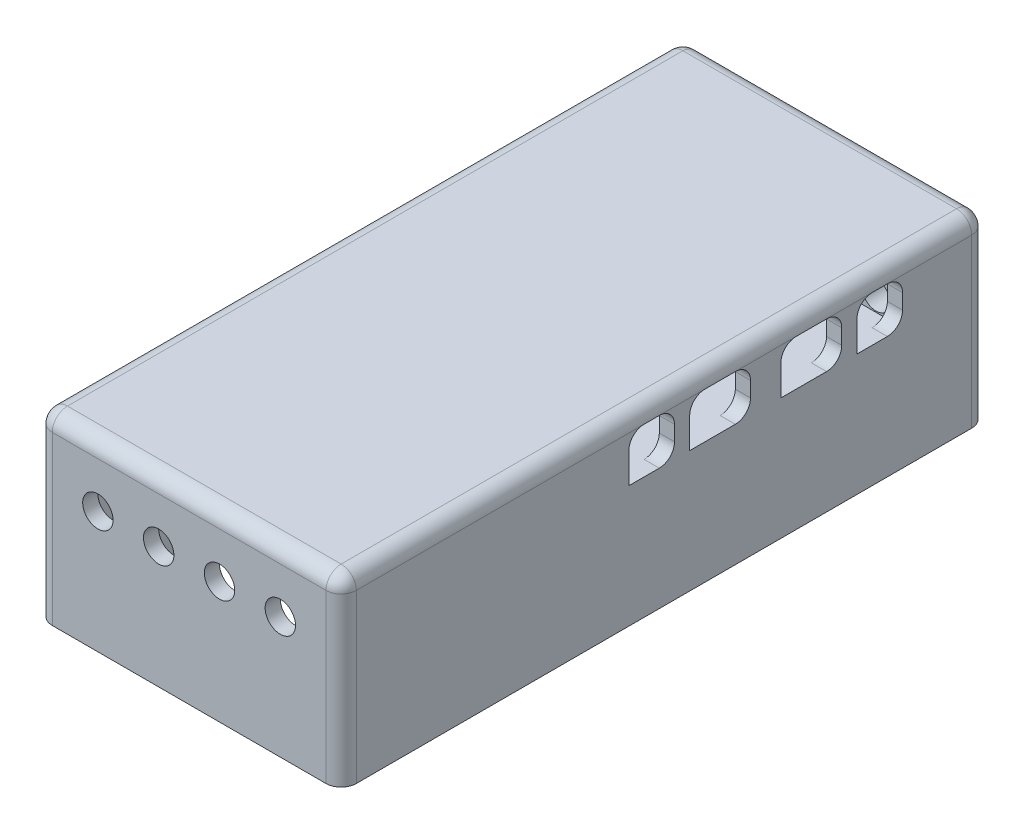
from build123d import *

# Parameters (mm, degrees)
BOSS_EXTRUDE1_DEPTH = 18
SKETCH2_R           = 0.925
CUT_EXTRUDE1_DEPTH  = 3
SKETCH4_W           = 42.475453112
SKETCH4_H           = 12
BOSS_EXTRUDE2_DEPTH = 1
SKETCH5_W           = 42.475453112
SKETCH5_H           = 12
BOSS_EXTRUDE3_DEPTH = 1
SKETCH6_W           = 3
SKETCH6_H           = 3
SKETCH6_W_2         = 4
CUT_EXTRUDE2_DEPTH  = 48.044193641
FILLET1_R           = 1
FILLET2_R           = 1
SKETCH7_R           = 5
CUT_EXTRUDE3_DEPTH  = 1
SKETCH8_R           = 1
CUT_EXTRUDE4_DEPTH  = 1


with BuildPart() as part:
    # Sketch1 → Boss-Extrude1 (new body)
    with BuildSketch(Plane(origin=(95.165105206, 0, 0), x_dir=(0, 0, -1), z_dir=(1, 0, 0))):
        Polygon((34.286183253, -5.063386162), (16.286183253, -5.063386162), (16.286183253, -1.063386162), (-0.638816747, -1.063386162), (-0.638816747, -12.063386162), (-1.638816747, -12.063386162), (-1.638816747, -0.063386162), (0.242411468, -0.063386162), (19.150462688, -0.063386162), (40.836636365, -0.063386162), (40.836636365, -12.063386162), (39.036636365, -12.063386162), (39.036636365, -1.063386162), (17.286183253, -1.063386162), (17.286183253, -4.063386162), (35.286183253, -4.063386162), (35.286183253, -12.063386162), (34.286183253, -12.063386162), align=None)
    extrude(amount=BOSS_EXTRUDE1_DEPTH)

    # Sketch2 → Cut-Extrude1 (cut)
    with BuildSketch(Plane(origin=(0, 0, -40.836636365), x_dir=(-1, 0, 0), z_dir=(0, 0, -1))):
        with BuildLine():
            Line((-107.105470333, -6.019636162), (-105.000073019, -6.019636162))
            ThreePointArc((-105.000073019, -6.019636162), (-108.665105206, -3.063386162), (-112.330137394, -6.019636162))
            Line((-112.330137394, -6.019636162), (-110.22474008, -6.019636162))
            ThreePointArc((-110.22474008, -6.019636162), (-108.665105206, -5.063386162), (-107.105470333, -6.019636162))
        make_face()
        with BuildLine():
            ThreePointArc((-110.22474008, -7.607136162), (-108.665105206, -8.563386162), (-107.105470333, -7.607136162))
            Line((-107.105470333, -7.607136162), (-105.000073019, -7.607136162))
            ThreePointArc((-105.000073019, -7.607136162), (-108.665105206, -10.563386162), (-112.330137394, -7.607136162))
            Line((-112.330137394, -7.607136162), (-110.22474008, -7.607136162))
        make_face()
        with Locations((-108.665105206, -6.813386162)):
            Circle(SKETCH2_R)
        with Locations((-99.665105206, -6.813386162)):
            Circle(SKETCH2_R)
        with BuildLine():
            Line((-98.105470333, -6.019636162), (-96.000073019, -6.019636162))
            ThreePointArc((-96.000073019, -6.019636162), (-99.665105206, -3.063386162), (-103.330137394, -6.019636162))
            Line((-103.330137394, -6.019636162), (-101.22474008, -6.019636162))
            ThreePointArc((-101.22474008, -6.019636162), (-99.665105206, -5.063386162), (-98.105470333, -6.019636162))
        make_face()
        with BuildLine():
            Line((-101.22474008, -7.607136162), (-103.330137394, -7.607136162))
            ThreePointArc((-103.330137394, -7.607136162), (-99.665105206, -10.563386162), (-96.000073019, -7.607136162))
            Line((-96.000073019, -7.607136162), (-98.105470333, -7.607136162))
            ThreePointArc((-98.105470333, -7.607136162), (-99.665105206, -8.563386162), (-101.22474008, -7.607136162))
        make_face()
    extrude(amount=-CUT_EXTRUDE1_DEPTH, mode=Mode.SUBTRACT)

    # Sketch4 → Boss-Extrude2 (add)
    with BuildSketch(Plane(origin=(113.165105206, 0, 0), x_dir=(0, 0, -1), z_dir=(1, 0, 0))):
        with Locations((19.598909809, -6.063386162)):
            Rectangle(SKETCH4_W, SKETCH4_H)
    extrude(amount=BOSS_EXTRUDE2_DEPTH)

    # Sketch5 → Boss-Extrude3 (add)
    with BuildSketch(Plane.ZY.offset(-95.165105206)):
        with Locations((-19.598909809, -6.063386162)):
            Rectangle(SKETCH5_W, SKETCH5_H)
    extrude(amount=BOSS_EXTRUDE3_DEPTH)

    # Sketch6 → Cut-Extrude2 (cut, through all)
    with BuildSketch(Plane.ZY.offset(-94.165105206)):
        with Locations((-18.786183253, -2.563386162)):
            Rectangle(SKETCH6_W, SKETCH6_H)
        with Locations((-23.286183253, -2.563386162)):
            Rectangle(SKETCH6_W_2, SKETCH6_H)
        with Locations((-29.286183253, -2.563386162)):
            Rectangle(SKETCH6_W_2, SKETCH6_H)
        with Locations((-33.786183253, -2.563386162)):
            Rectangle(SKETCH6_W, SKETCH6_H)
    extrude(amount=-CUT_EXTRUDE2_DEPTH, mode=Mode.SUBTRACT)

    # Fillet1
    fillet1_edges = [part.edges().sort_by_distance(p)[0] for p in [
        (113.665105206, -4.063386162, -20.286183253),
        (113.665105206, -1.063386162, -20.286183253),
        (94.665105206, -4.063386162, -20.286183253),
        (94.665105206, -1.063386162, -20.286183253),
        (113.665105206, -1.063386162, -21.286183253),
        (113.665105206, -4.063386162, -25.286183253),
        (113.665105206, -1.063386162, -25.286183253),
        (94.665105206, -1.063386162, -21.286183253),
        (94.665105206, -4.063386162, -25.286183253),
        (94.665105206, -1.063386162, -25.286183253),
        (113.665105206, -1.063386162, -27.286183253),
        (113.665105206, -4.063386162, -31.286183253),
        (113.665105206, -1.063386162, -31.286183253),
        (94.665105206, -1.063386162, -27.286183253),
        (94.665105206, -4.063386162, -31.286183253),
        (94.665105206, -1.063386162, -31.286183253),
        (113.665105206, -4.063386162, -35.286183253),
        (113.665105206, -1.063386162, -35.286183253),
        (113.665105206, -1.063386162, -32.286183253),
        (94.665105206, -4.063386162, -35.286183253),
        (94.665105206, -1.063386162, -35.286183253),
        (94.665105206, -1.063386162, -32.286183253),
        (104.165105206, -1.063386162, -17.286183253),
    ]]
    fillet(fillet1_edges, radius=FILLET1_R)

    # Fillet2
    fillet2_edges = [part.edges().sort_by_distance(p)[0] for p in [
        (114.165105206, -6.063386162, -40.836636365),
        (114.165105206, -0.063386162, -19.598909809),
        (114.165105206, -6.063386162, 1.638816747),
        (94.165105206, -6.063386162, -40.836636365),
        (94.165105206, -6.063386162, 1.638816747),
        (94.165105206, -0.063386162, -19.598909809),
        (104.165105206, -0.063386162, -40.836636365),
        (104.165105206, -0.063386162, 1.638816747),
    ]]
    fillet(fillet2_edges, radius=FILLET2_R - 0.0001)  # a hair under: the kernel refuses the full size

    # Sketch7 → Cut-Extrude3 (cut)
    with BuildSketch(Plane(origin=(0, -4.063386162, 0), x_dir=(1, 0, 0), z_dir=(0, 1, 0))):
        with Locations(Location((103.665105206, 26.786183253, 0), (0, 0, 270))):
            Circle(SKETCH7_R)
    extrude(amount=-CUT_EXTRUDE3_DEPTH, mode=Mode.SUBTRACT)

    # Sketch8 → Cut-Extrude4 (cut)
    with BuildSketch(Plane.XY.offset(1.638816747)):
        with Locations((98.165105206, -4.063386162)):
            Circle(SKETCH8_R)
        with Locations((102.165105206, -4.063386162)):
            Circle(SKETCH8_R)
        with Locations((106.165105206, -4.063386162)):
            Circle(SKETCH8_R)
        with Locations((110.165105206, -4.063386162)):
            Circle(SKETCH8_R)
    extrude(amount=-CUT_EXTRUDE4_DEPTH, mode=Mode.SUBTRACT)


solid = part.part
